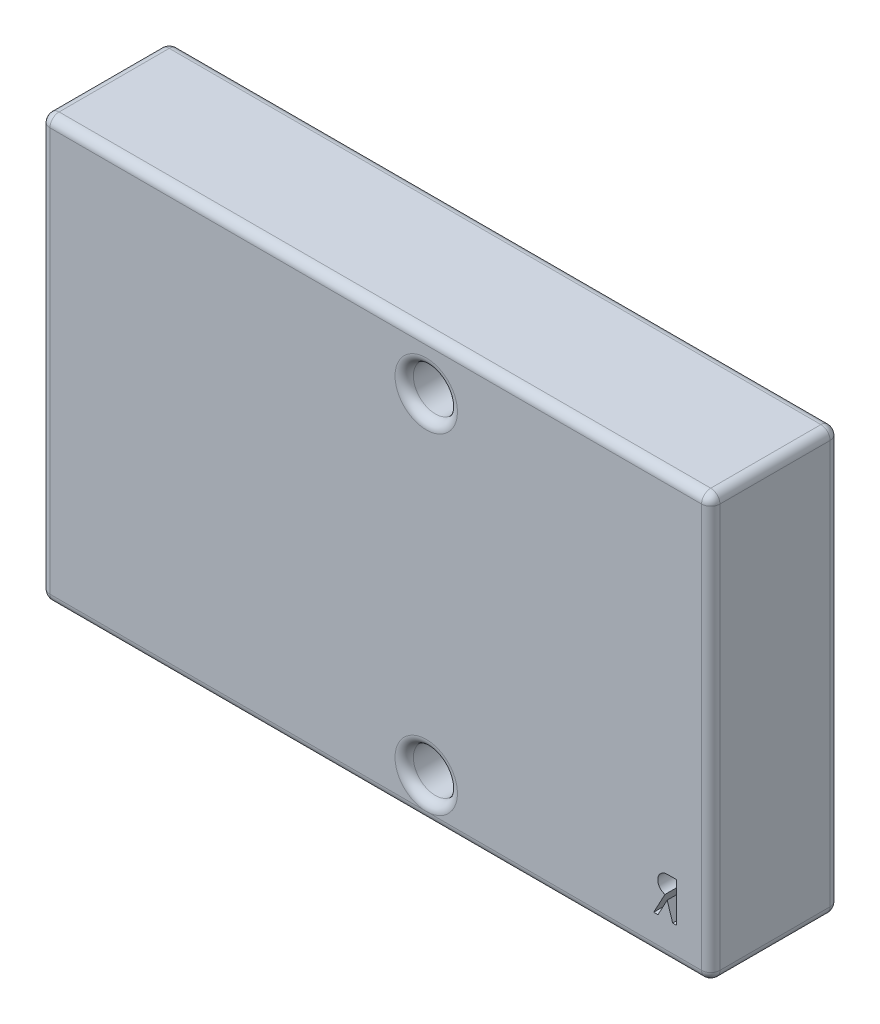
from build123d import *

# Parameters (mm, degrees)
SKETCH1_W           = 36.5
SKETCH1_H           = 7
BOSS_EXTRUDE1_DEPTH = 23
SKETCH2_R           = 1.375
CUT_EXTRUDE1_DEPTH  = 8.5
SKETCH4_R           = 1.2
CUT_EXTRUDE2_DEPTH  = 7
FILLET1_R           = 0.5
CUT_EXTRUDE3_DEPTH  = 44.706406853


with BuildPart() as part:
    # Sketch1 → Boss-Extrude1 (new body)
    with BuildSketch(Plane(origin=(0, 0, 0), x_dir=(1, 0, 0), z_dir=(0, 1, 0))):
        with Locations((18.25, -3.5)):
            Rectangle(SKETCH1_W, SKETCH1_H)
    extrude(amount=BOSS_EXTRUDE1_DEPTH)

    # Sketch2 → Cut-Extrude1 (cut)
    with BuildSketch(Plane.XZ):
        with Locations(Location((8, 3, 0), (0, 0, 270))):
            Circle(SKETCH2_R)
        with Locations(Location((28.5, 3, 0), (0, 0, 270))):
            Circle(SKETCH2_R)
    extrude(amount=-CUT_EXTRUDE1_DEPTH, mode=Mode.SUBTRACT)

    # Sketch4 → Cut-Extrude2 (cut)
    with BuildSketch(Plane(origin=(0, 0, 0), x_dir=(-1, 0, 0), z_dir=(0, 0, -1))):
        with Locations((-21, 2.2)):
            Circle(SKETCH4_R)
        with Locations((-21, 20.2)):
            Circle(SKETCH4_R)
    extrude(amount=-CUT_EXTRUDE2_DEPTH, mode=Mode.SUBTRACT)

    # Fillet1
    fillet1_edges = [part.edges().sort_by_distance(p)[0] for p in [
        (36.5, 23, 3.5),
        (8, 0, 4.375),
        (18.25, 23, 0),
        (28.5, 0, 4.375),
        (22.2, 2.2, 7),
        (22.2, 2.2, 0),
        (22.2, 20.2, 7),
        (22.2, 20.2, 0),
        (0, 23, 3.5),
        (18.25, 0, 0),
        (36.5, 0, 3.5),
        (18.25, 0, 7),
        (0, 0, 3.5),
        (0, 11.5, 0),
        (36.5, 11.5, 0),
        (36.5, 11.5, 7),
        (0, 11.5, 7),
        (18.25, 23, 7),
    ]]
    fillet(fillet1_edges, radius=FILLET1_R - 0.0001)  # a hair under: the kernel refuses the full size

    # Sketch6 → Cut-Extrude3 (cut, through all)
    with BuildSketch(Plane(origin=(0, 0, 0), x_dir=(-1, 0, 0), z_dir=(0, 0, -1))):
        with BuildLine():
            Line((-34.626303685, 1.94294274), (-34.626303685, 4.098453698))
            Line((-34.626303685, 4.098453698), (-34.126303685, 4.098453698))
            ThreePointArc((-34.126303685, 4.098453698), (-33.615970927, 3.645665749), (-34.004771514, 3.085049521))
            Line((-34.004771514, 3.085049521), (-33.393275473, 1.94))
            Line((-33.393275473, 1.94), (-33.626303685, 1.94))
            Line((-33.626303685, 1.94), (-34.126303685, 2.876268958))
            Line((-34.126303685, 2.876268958), (-34.426303685, 1.94294274))
            Line((-34.426303685, 1.94294274), (-34.626303685, 1.94294274))
        make_face()
    extrude(amount=-CUT_EXTRUDE3_DEPTH, mode=Mode.SUBTRACT)


solid = part.part
